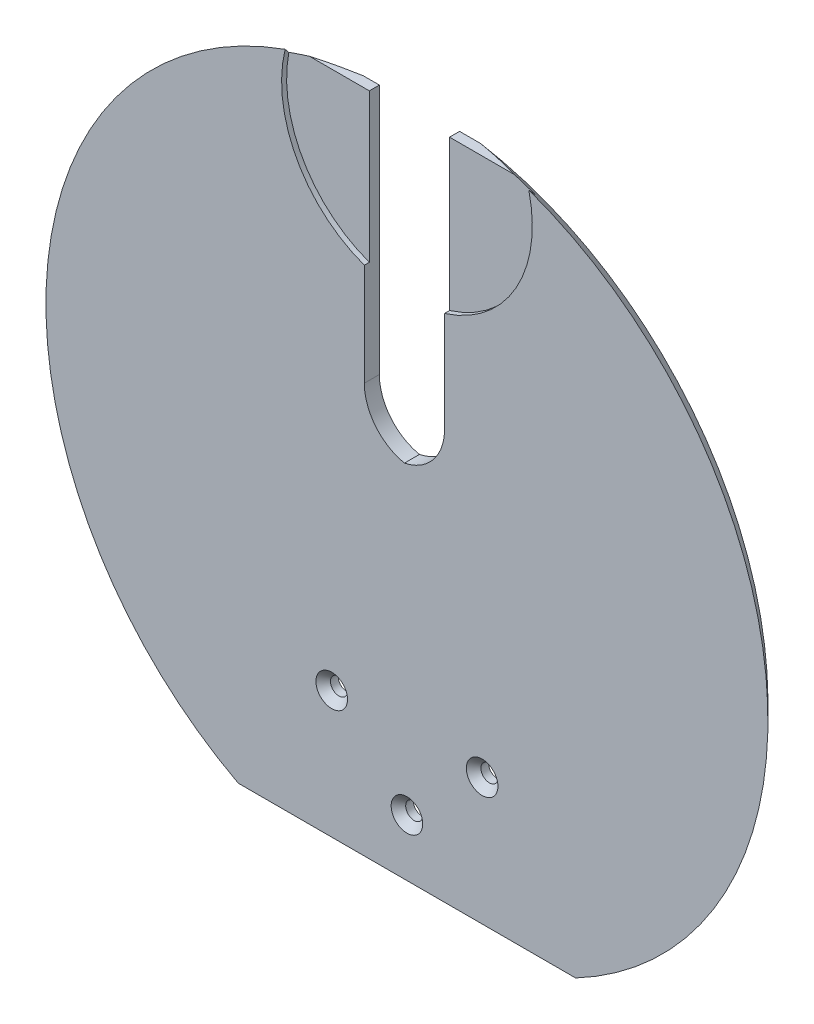
from build123d import *

# Parameters (mm, degrees)
BOSS_EXTRUDE2_DEPTH                                 = 3
CSK_FOR_M3_COUNTERSUNK_FLAT_HEAD_SCREW1_D           = 3.4
CSK_FOR_M3_COUNTERSUNK_FLAT_HEAD_SCREW1_DEPTH       = 3
CSK_FOR_M3_COUNTERSUNK_FLAT_HEAD_SCREW1_CSINK_D     = 6.3
CSK_FOR_M3_COUNTERSUNK_FLAT_HEAD_SCREW1_CSINK_ANGLE = 90
CSK_FOR_M3_COUNTERSUNK_FLAT_HEAD_SCREW1_TIP         = 1.021463052
SKETCH4_W                                           = 16
SKETCH4_H                                           = 60
CUT_EXTRUDE1_DEPTH                                  = 3
SKETCH5_R                                           = 25
CUT_EXTRUDE2_DEPTH                                  = 1
FILLET1_R                                           = 10
CUT_EXTRUDE3_DEPTH                                  = 21
CHAMFER2_SIZE                                       = 5
CHAMFER2_SIZE_2                                     = 2.886751346


with BuildPart() as part:
    # Sketch1 → Boss-Extrude2 (new body)
    with BuildSketch(Plane.XY):
        with BuildLine():
            Line((-23.664319132, 68), (23.664319132, 68))
            ThreePointArc((23.664319132, 68), (0, -72), (-23.664319132, 68))
        make_face()
    extrude(amount=BOSS_EXTRUDE2_DEPTH)

    # CSK for M3 Countersunk Flat Head Screw1
    with Locations(Plane.XY.offset(3)):
        with Locations((15, -38.31), (-15, -38.31), (0, -52.31)):
            CounterSinkHole(CSK_FOR_M3_COUNTERSUNK_FLAT_HEAD_SCREW1_D / 2, CSK_FOR_M3_COUNTERSUNK_FLAT_HEAD_SCREW1_CSINK_D / 2, depth=CSK_FOR_M3_COUNTERSUNK_FLAT_HEAD_SCREW1_DEPTH, counter_sink_angle=CSK_FOR_M3_COUNTERSUNK_FLAT_HEAD_SCREW1_CSINK_ANGLE)
            with Locations((0, 0, -(CSK_FOR_M3_COUNTERSUNK_FLAT_HEAD_SCREW1_DEPTH + CSK_FOR_M3_COUNTERSUNK_FLAT_HEAD_SCREW1_TIP / 2))):  # 118° drill point
                Cone(0, CSK_FOR_M3_COUNTERSUNK_FLAT_HEAD_SCREW1_D / 2, CSK_FOR_M3_COUNTERSUNK_FLAT_HEAD_SCREW1_TIP, mode=Mode.SUBTRACT)

    # Sketch4 → Cut-Extrude1 (cut)
    with BuildSketch(Plane.XY.offset(3)):
        with Locations((-0.5, 38)):
            Rectangle(SKETCH4_W, SKETCH4_H)
    extrude(amount=-CUT_EXTRUDE1_DEPTH, mode=Mode.SUBTRACT)

    # Sketch5 → Cut-Extrude2 (cut)
    with BuildSketch(Plane.XY.offset(3)):
        with Locations((0, 61.9)):
            Circle(SKETCH5_R)
    extrude(amount=-CUT_EXTRUDE2_DEPTH, mode=Mode.SUBTRACT)

    # Fillet1
    # the kernel refuses this fillet: 10 mm, written as the material it adds along each edge
    with BuildSketch(Plane(origin=(-8.5, 8, 3), x_dir=(1, 0, 0), z_dir=(0, 0, -1)), Plane(origin=(7.5, 8, 3), x_dir=(0, 1, 0), z_dir=(0, 0, -1))) as fillet1_piece_1:
        with BuildLine():
            CenterArc((FILLET1_R, -FILLET1_R), FILLET1_R, 90, 90)
            Line((0, -FILLET1_R), (0, 0))
            Line((0, 0), (FILLET1_R, 0))
        make_face()
    extrude(amount=3)

    # Sketch1<3> → Cut-Extrude3 (cut)
    with BuildSketch(Plane.XY):
        with BuildLine():
            Line((31.363416587, -64.81), (-31.363416587, -64.81))
            ThreePointArc((-31.363416587, -64.81), (0, -72), (31.363416587, -64.81))
        make_face()
    extrude(amount=CUT_EXTRUDE3_DEPTH, mode=Mode.SUBTRACT)

    # Chamfer2
    # the kernel refuses this chamfer: 5, 2.886751346 mm, written as the material it takes off along each edge
    with BuildSketch(Plane(origin=(44.29884536, -64.81, 0), x_dir=(0, -0.019326765612699606, 0.9998132206222079), z_dir=(-1, 0, 0))) as chamfer2_piece_1:
        Polygon((CHAMFER2_SIZE * 0.999813220622, CHAMFER2_SIZE * 0.0193267656127), (-CHAMFER2_SIZE_2 * 0.0193267656124, CHAMFER2_SIZE_2 * 0.999813220604), (0, 0), align=None)
    extrude(amount=88.59769072, mode=Mode.SUBTRACT)

    # Chamfer3
    # the kernel refuses this chamfer: 3 mm, written as the material it takes off along each edge
    with BuildSketch(Plane(origin=(0, 0, 0), x_dir=(0.07743421660335849, 0.9969974634366048, 0), z_dir=(-0.9969974634366048, 0.07743421660335849, 0))) as chamfer3_piece_1:
        with BuildLine():
            Line((72.084852814, -3.084852814), (68.915147186, 0.084852814))
            Line((68.915147186, 0.084852814), (68.915147186, 0.144852814))
            ThreePointArc((68.915147186, 0.144852814), (70.457573593, 0.06), (72, 0.06))
            Line((72, 0.06), (72.06, 0))
            ThreePointArc((72.06, 0), (72.06, -1.542426407), (72.144852814, -3.084852814))
            Line((72.144852814, -3.084852814), (72.084852814, -3.084852814))
        make_face()
    revolve(axis=Axis((0, 0, 0), (0, 0, -1)), revolution_arc=159.627586722, mode=Mode.SUBTRACT)
    with BuildSketch(Plane(origin=(0, 0, 0), x_dir=(-0.27448479603236836, -0.9615914396182347, 0), z_dir=(0.9615914396182347, -0.27448479603236836, 0))) as chamfer3_piece_2:
        with BuildLine():
            Line((72.084852814, -3.084852814), (68.915147186, 0.084852814))
            Line((68.915147186, 0.084852814), (68.915147186, 0.144852814))
            ThreePointArc((68.915147186, 0.144852814), (70.457573593, 0.06), (72, 0.06))
            Line((72, 0.06), (72.06, 0))
            ThreePointArc((72.06, 0), (72.06, -1.542426407), (72.144852814, -3.084852814))
            Line((72.144852814, -3.084852814), (72.084852814, -3.084852814))
        make_face()
    revolve(axis=Axis((0, 0, 0), (0, 0, -1)), revolution_arc=159.627586722, mode=Mode.SUBTRACT)


solid = part.part
